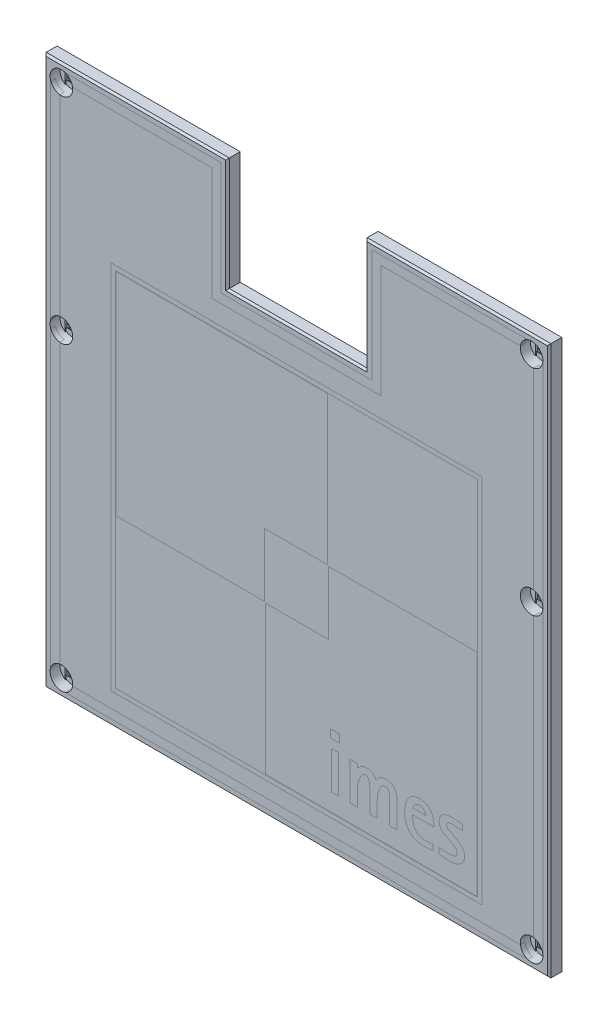
from build123d import *
from build123d.topology import SkipClean

# Parameters (mm, degrees)
SKETCH1_R                 = 1.35
BOSS_EXTRUDE1_DEPTH       = 2.8
SKETCH3_R                 = 2.5
CUT_EXTRUDE1_DEPTH        = 2.2
SKETCH4_W                 = 91.5
SKETCH4_H                 = 85.5
CUT_EXTRUDE2_DEPTH        = 1.5
CUT_EXTRUDE3_DEPTH        = 0.2
SKETCH6_W                 = 2.7
SKETCH6_H                 = 2.7
CUT_EXTRUDE4_DEPTH        = 0.2
CHAMFER1_SIZE             = 0.4
CUT_EXTRUDE5_DEPTH        = 1
BOSS_EXTRUDE2_DEPTH       = 1
BOSS_EXTRUDE2_2_DEPTH     = 1
SKETCH10_W                = 82
SKETCH10_H                = 82
SKETCH10_W_2              = 80
SKETCH10_H_2              = 80
CUT_EXTRUDE6_DEPTH        = 1
SKETCH10_2_W              = 82
SKETCH10_2_H              = 82
SKETCH10_2_W_2            = 80
SKETCH10_2_H_2            = 80
BOSS_EXTRUDE3_DEPTH       = 1
CUT_EXTRUDE7_START        = -1
CUT_EXTRUDE7_OUTLINE_W    = 1.635
CUT_EXTRUDE7_OUTLINE_H    = 8.32
CUT_EXTRUDE7_OUTLINE_W_2  = 1.94
CUT_EXTRUDE7_OUTLINE_H_2  = 1.76
CUT_EXTRUDE7_DEPTH        = 1
BOSS_EXTRUDE4_START       = -1
BOSS_EXTRUDE4_OUTLINE_W   = 1.635
BOSS_EXTRUDE4_OUTLINE_H   = 8.32
BOSS_EXTRUDE4_OUTLINE_W_2 = 1.94
BOSS_EXTRUDE4_OUTLINE_H_2 = 1.76
BOSS_EXTRUDE4_DEPTH       = 1
CUT_EXTRUDE8_DEPTH        = 1
BOSS_EXTRUDE5_DEPTH       = 1
BOSS_EXTRUDE5_2_DEPTH     = 1
BOSS_EXTRUDE5_3_DEPTH     = 1
BOSS_EXTRUDE5_4_DEPTH     = 1
BOSS_EXTRUDE5_5_DEPTH     = 1
BOSS_EXTRUDE5_6_DEPTH     = 1


# Read off the part's stored shape, not the designer's step: Cut-Extrude7, Boss-Extrude4
with BuildPart() as part:
    # Sketch1 → Boss-Extrude1 (new body)
    with BuildSketch(Plane.XY):
        Polygon((-15.25, 53.75), (-15.25, 28.75), (15.25, 28.75), (15.25, 53.75), (55.875, 53.75), (55.875, -67.75), (-55.75, -67.75), (-55.75, 53.75), align=None)
        with Locations((-52, 50)):
            Circle(SKETCH1_R, mode=Mode.SUBTRACT)
        with Locations((-52, 2.6)):
            Circle(SKETCH1_R, mode=Mode.SUBTRACT)
        with Locations((-52, -64)):
            Circle(SKETCH1_R, mode=Mode.SUBTRACT)
        with Locations((52, 50)):
            Circle(SKETCH1_R, mode=Mode.SUBTRACT)
        with Locations((52, 2.6)):
            Circle(SKETCH1_R, mode=Mode.SUBTRACT)
        with Locations((52, -64)):
            Circle(SKETCH1_R, mode=Mode.SUBTRACT)
    extrude(amount=BOSS_EXTRUDE1_DEPTH)

    # Sketch3 → Cut-Extrude1 (cut)
    with BuildSketch(Plane.XY.offset(2.8)):
        with Locations((-52, 50)):
            Circle(SKETCH3_R)
        with Locations((-52, 2.6)):
            Circle(SKETCH3_R)
        with Locations((-52, -64)):
            Circle(SKETCH3_R)
        with Locations((52, -64)):
            Circle(SKETCH3_R)
        with Locations((52, 2.6)):
            Circle(SKETCH3_R)
        with Locations((52, 50)):
            Circle(SKETCH3_R)
    extrude(amount=-CUT_EXTRUDE1_DEPTH, mode=Mode.SUBTRACT)

    # Sketch4 → Cut-Extrude2 (cut)
    with BuildSketch(Plane(origin=(0, 0, 0), x_dir=(-1, 0, 0), z_dir=(0, 0, -1))):
        with Locations((0, -15)):
            Rectangle(SKETCH4_W, SKETCH4_H)
    extrude(amount=-CUT_EXTRUDE2_DEPTH, mode=Mode.SUBTRACT)

    # Sketch5 → Cut-Extrude3 (cut)
    with SkipClean():  # the faces are left unmerged after this step: merging them gives an invalid solid
        with BuildSketch(Plane.XY.offset(0.6)):
            with BuildLine():
                Line((-53.35, 47.895837459), (-53.35, 52.104162541))
                ThreePointArc((-53.35, 52.104162541), (-52, 52.5), (-50.65, 52.104162541))
                Line((-50.65, 52.104162541), (-50.65, 47.895837459))
                ThreePointArc((-50.65, 47.895837459), (-52, 47.5), (-53.35, 47.895837459))
            make_face()
            with BuildLine():
                Line((-53.35, 0.495837459), (-53.35, 4.704162541))
                ThreePointArc((-53.35, 4.704162541), (-52, 5.1), (-50.65, 4.704162541))
                Line((-50.65, 4.704162541), (-50.65, 0.495837459))
                ThreePointArc((-50.65, 0.495837459), (-52, 0.1), (-53.35, 0.495837459))
            make_face()
            with BuildLine():
                Line((-53.35, -66.104162541), (-53.35, -61.895837459))
                ThreePointArc((-53.35, -61.895837459), (-52, -61.5), (-50.65, -61.895837459))
                Line((-50.65, -61.895837459), (-50.65, -66.104162541))
                ThreePointArc((-50.65, -66.104162541), (-52, -66.5), (-53.35, -66.104162541))
            make_face()
        cut_extrude3 = extrude(amount=-CUT_EXTRUDE3_DEPTH, mode=Mode.SUBTRACT)

    # Sketch6 → Cut-Extrude4 (cut)
    with SkipClean():  # the faces are left unmerged after this step: merging them gives an invalid solid
        with BuildSketch(Plane.XY.offset(0.4)):
            with Locations((-52, -64)):
                Rectangle(SKETCH6_W, SKETCH6_H)
            with Locations((-52, 2.6)):
                Rectangle(SKETCH6_W, SKETCH6_H)
            with Locations((-52, 50)):
                Rectangle(SKETCH6_W, SKETCH6_H)
        cut_extrude4 = extrude(amount=-CUT_EXTRUDE4_DEPTH, mode=Mode.SUBTRACT)

    # Mirror1: Cut-Extrude3, Cut-Extrude4 across plane
    with SkipClean():  # the faces are left unmerged after this step: merging them gives an invalid solid
        add(cut_extrude3.mirror(Plane(origin=(0, 0, 0), x_dir=(0, 0, 1), z_dir=(1, 0, 0))), mode=Mode.SUBTRACT)
        add(cut_extrude4.mirror(Plane(origin=(0, 0, 0), x_dir=(0, 0, 1), z_dir=(1, 0, 0))), mode=Mode.SUBTRACT)

    # Chamfer1
    chamfer1_edges = [part.edges().sort_by_distance(p)[0] for p in [
        (55.875, -7, 2.8),
        (35.5625, 53.75, 2.8),
        (15.25, 41.25, 2.8),
        (0, 28.75, 2.8),
        (-15.25, 41.25, 2.8),
        (-35.5, 53.75, 2.8),
        (-55.75, -7, 2.8),
        (0.0625, -67.75, 2.8),
    ]]
    chamfer(chamfer1_edges, length=CHAMFER1_SIZE)

    # Sketch8 → Cut-Extrude5 (cut)
    with SkipClean():  # the faces are left unmerged after this step: merging them gives an invalid solid
        with BuildSketch(Plane.XY.offset(2.8)):
            Polygon((6.9, -12.9), (6.9, 19.9), (-39.9, 19.9), (-39.9, -26.9), (-7.1, -26.9), (-7.1, -12.9), align=None)
            Polygon((7.1, -13.1), (39.9, -13.1), (39.9, -59.9), (-6.9, -59.9), (-6.9, -27.1), (7.1, -27.1), align=None)
        extrude(amount=-CUT_EXTRUDE5_DEPTH, mode=Mode.SUBTRACT)

    # Sketch10 → Cut-Extrude6 (cut)
    with SkipClean():  # the faces are left unmerged after this step: merging them gives an invalid solid
        with BuildSketch(Plane.XY.offset(2.8)):
            with Locations((0, -20)):
                Rectangle(SKETCH10_W, SKETCH10_H)
            with Locations((0, -20)):
                Rectangle(SKETCH10_W_2, SKETCH10_H_2, mode=Mode.SUBTRACT)
        extrude(amount=-CUT_EXTRUDE6_DEPTH, mode=Mode.SUBTRACT)

    # Sketch12 → Cut-Extrude8 (cut)
    with SkipClean():  # the faces are left unmerged after this step: merging them gives an invalid solid
        with BuildSketch(Plane.XY.offset(2.8)):
            with BuildLine():
                Line((51.147063895, 52.35), (16.65, 52.35))
                Line((16.65, 52.35), (16.65, 27.35))
                Line((16.65, 27.35), (-16.65, 27.35))
                Line((-16.65, 27.35), (-16.65, 52.35))
                Line((-16.65, 52.35), (-51.147063895, 52.35))
                ThreePointArc((-51.147063895, 52.35), (-50.05850059, 51.574985727), (-49.524621241, 50.35))
                Line((-49.524621241, 50.35), (-18.65, 50.35))
                Line((-18.65, 50.35), (-18.65, 25.35))
                Line((-18.65, 25.35), (18.65, 25.35))
                Line((18.65, 25.35), (18.65, 50.35))
                Line((18.65, 50.35), (49.524621241, 50.35))
                ThreePointArc((49.524621241, 50.35), (50.05850059, 51.574985727), (51.147063895, 52.35))
            make_face()
            with BuildLine():
                Line((52.475, 5.054460226), (52.475, 47.545539774))
                ThreePointArc((52.475, 47.545539774), (53.811079021, 48.276633301), (54.475, 49.647331601))
                Line((54.475, 49.647331601), (54.475, 2.952668399))
                ThreePointArc((54.475, 2.952668399), (53.811079021, 4.323366699), (52.475, 5.054460226))
            make_face()
            with BuildLine():
                Line((-52.35, 0.124621241), (-52.35, -61.524621241))
                ThreePointArc((-52.35, -61.524621241), (-53.574985727, -62.05850059), (-54.35, -63.147063895))
                Line((-54.35, -63.147063895), (-54.35, 1.747063895))
                ThreePointArc((-54.35, 1.747063895), (-53.574985727, 0.65850059), (-52.35, 0.124621241))
            make_face()
            with BuildLine():
                Line((-54.35, 49.147063895), (-54.35, 3.452936105))
                ThreePointArc((-54.35, 3.452936105), (-53.574985727, 4.54149941), (-52.35, 5.075378759))
                Line((-52.35, 5.075378759), (-52.35, 47.524621241))
                ThreePointArc((-52.35, 47.524621241), (-53.574985727, 48.05850059), (-54.35, 49.147063895))
            make_face()
            with BuildLine():
                Line((-51.147063895, -66.35), (51.147063895, -66.35))
                ThreePointArc((51.147063895, -66.35), (50.05850059, -65.574985727), (49.524621241, -64.35))
                Line((49.524621241, -64.35), (-49.524621241, -64.35))
                ThreePointArc((-49.524621241, -64.35), (-50.05850059, -65.574985727), (-51.147063895, -66.35))
            make_face()
            with BuildLine():
                Line((54.475, -63.647331601), (54.475, 2.247331601))
                ThreePointArc((54.475, 2.247331601), (53.811079021, 0.876633301), (52.475, 0.145539774))
                Line((52.475, 0.145539774), (52.475, -61.545539774))
                ThreePointArc((52.475, -61.545539774), (53.811079021, -62.276633301), (54.475, -63.647331601))
            make_face()
        extrude(amount=-CUT_EXTRUDE8_DEPTH, mode=Mode.SUBTRACT)


with BuildPart() as body_2:
    # Sketch9 → Boss-Extrude2 (new body)
    with BuildSketch(Plane.XY.offset(1.8)):
        Polygon((39.9, -59.9), (39.9, -13.1), (7.1, -13.1), (7.1, -27.1), (-6.9, -27.1), (-6.9, -59.9), align=None)
    extrude(amount=BOSS_EXTRUDE2_DEPTH)

    # Cut-Extrude7 outline → Cut-Extrude7 (cut)
    # profile 1 of 5: a face of its own
    with BuildSketch(Plane.XY.offset(2.8).offset(CUT_EXTRUDE7_START)):
        with BuildLine():
            add(Edge.make_bspline(
                [(31.520459916, -54.72), (31.630427377, -54.731182686), (31.843603955, -54.752860796), (32.153091085, -54.778570637), (32.440447598, -54.806827377), (32.796651345, -54.841381981), (33.235755714, -54.87281791), (33.58706238, -54.877581165), (33.765459916, -54.88)],
                knots=[0, 0, 0, 0, 0.147269477, 0.285488116, 0.413756125, 0.53197116, 0.762329612, 1, 1, 1, 1], degree=3))
            Line((31.520459916, -54.72), (31.520459916, -55.98))
            add(Edge.make_bspline(
                [(33.885459916, -56.16), (33.697090473, -56.157077545), (33.314262679, -56.151138167), (32.731211473, -56.118574014), (32.13106025, -56.060153814), (31.726152205, -56.007001331), (31.520459916, -55.98)],
                knots=[0, 0, 0, 0, 0.238089541, 0.483875157, 0.737809853, 1, 1, 1, 1], degree=3))
            add(Edge.make_bspline(
                [(37.205459916, -53.5975), (37.20333471, -53.706084515), (37.19922283, -53.916175408), (37.146126775, -54.218538928), (37.069130031, -54.499058325), (36.951548025, -54.753332217), (36.807309638, -54.984027916), (36.64180186, -55.19827446), (36.444943527, -55.386837877), (36.226400229, -55.557812543), (35.987633381, -55.707200868), (35.727782533, -55.832687111), (35.45263921, -55.940692208), (35.158816143, -56.021519062), (34.853720028, -56.083268359), (34.53912287, -56.128890852), (34.215005089, -56.153066547), (33.996328482, -56.157667385), (33.885459916, -56.16)],
                knots=[0, 0, 0, 0, 0.06869843, 0.132918718, 0.19390058, 0.252486582, 0.30961806, 0.36601068, 0.423499545, 0.481789897, 0.541550867, 0.601516658, 0.664355231, 0.72852777, 0.794268313, 0.861457425, 0.929759215, 1, 1, 1, 1], degree=3))
            add(Edge.make_bspline(
                [(35.152959916, -51.055), (35.300724295, -51.137308537), (35.58723823, -51.296904125), (35.984011337, -51.558232959), (36.335547149, -51.830223752), (36.595028748, -52.067832941), (36.77775913, -52.266076561), (36.891035125, -52.426568886), (36.987777008, -52.595758794), (37.070286267, -52.774822655), (37.127979946, -52.96633288), (37.175153709, -53.167190701), (37.198377128, -53.379466615), (37.203076397, -53.524126809), (37.205459916, -53.5975)],
                knots=[0, 0, 0, 0, 0.146602911, 0.284261859, 0.41143371, 0.531573362, 0.588871508, 0.644805216, 0.701439079, 0.757703084, 0.815282929, 0.874524845, 0.936357665, 1, 1, 1, 1], degree=3))
            Line((35.152959916, -51.055), (34.522959916, -50.7125))
            add(Edge.make_bspline(
                [(33.220459916, -49.565), (33.224980368, -49.635951871), (33.233440024, -49.768732516), (33.317837187, -49.949651491), (33.453273196, -50.090586993), (33.615120664, -50.222599766), (33.810003776, -50.341789008), (34.025645806, -50.463454985), (34.269213861, -50.580059476), (34.43573295, -50.666972651), (34.522959916, -50.7125)],
                knots=[0, 0, 0, 0, 0.115632082, 0.216396018, 0.318864986, 0.433339301, 0.557913864, 0.692342793, 0.83884127, 1, 1, 1, 1], degree=3))
            add(Edge.make_bspline(
                [(34.495459916, -48.8), (34.403749255, -48.802055302), (34.229873945, -48.805951972), (33.9822984, -48.831192341), (33.763978534, -48.882557761), (33.572487051, -48.945791152), (33.409652716, -49.039632652), (33.298606506, -49.183574693), (33.230808175, -49.362728766), (33.224075979, -49.494318982), (33.220459916, -49.565)],
                knots=[0, 0, 0, 0, 0.16263944, 0.308350005, 0.440251024, 0.559421834, 0.665611291, 0.767606011, 0.875174278, 1, 1, 1, 1], degree=3))
            add(Edge.make_bspline(
                [(36.697959916, -48.96), (36.569611721, -48.948490665), (36.327041759, -48.92673875), (35.985504249, -48.893716725), (35.686351294, -48.865956959), (35.346548842, -48.836250343), (34.954352462, -48.804845049), (34.647198867, -48.80160208), (34.495459916, -48.8)],
                knots=[0, 0, 0, 0, 0.174996226, 0.330731786, 0.465974926, 0.582981318, 0.793985882, 1, 1, 1, 1], degree=3))
            Line((36.697959916, -48.96), (36.697959916, -47.7225))
            add(Edge.make_bspline(
                [(34.477959916, -47.52), (34.643013917, -47.522586355), (34.970156375, -47.527712597), (35.382816642, -47.557730433), (35.727918649, -47.596967108), (36.02113047, -47.626271206), (36.347847729, -47.675057686), (36.577090543, -47.70612147), (36.697959916, -47.7225)],
                knots=[0, 0, 0, 0, 0.221924356, 0.439861372, 0.555926354, 0.688942107, 0.835993234, 1, 1, 1, 1], degree=3))
            add(Edge.make_bspline(
                [(31.552959916, -49.725), (31.555967634, -49.627370608), (31.561807565, -49.437808584), (31.602927792, -49.165199054), (31.677128084, -48.916240618), (31.776014452, -48.688826998), (31.906562478, -48.487273649), (32.050549818, -48.301233263), (32.2205372, -48.141855775), (32.407736102, -47.999314262), (32.614906768, -47.878509362), (32.839672588, -47.774232138), (33.082598695, -47.693369691), (33.432313265, -47.606336703), (33.899301987, -47.534409076), (34.281834542, -47.524883689), (34.477959916, -47.52)],
                knots=[0, 0, 0, 0, 0.070383998, 0.13666103, 0.19806154, 0.25723182, 0.314737786, 0.370752562, 0.426418292, 0.482171488, 0.540077761, 0.598948381, 0.660504474, 0.724326199, 0.85866137, 1, 1, 1, 1], degree=3))
            add(Edge.make_bspline(
                [(33.470459916, -51.965), (33.353005623, -51.904920089), (33.119073438, -51.785259714), (32.77030412, -51.608686519), (32.443024903, -51.406625574), (32.151807968, -51.165062825), (31.903342509, -50.88330897), (31.739372623, -50.612147974), (31.642679575, -50.370555604), (31.591500783, -50.169701361), (31.557396866, -49.952824875), (31.554471977, -49.802640059), (31.552959916, -49.725)],
                knots=[0, 0, 0, 0, 0.125729609, 0.250414024, 0.372476009, 0.491442544, 0.609629887, 0.728937866, 0.791317999, 0.857002591, 0.926075568, 1, 1, 1, 1], degree=3))
            Line((33.470459916, -51.965), (34.195459916, -52.355))
            add(Edge.make_bspline(
                [(35.522959916, -53.705), (35.517873196, -53.62149059), (35.508097652, -53.461004111), (35.412722454, -53.239246327), (35.270902047, -53.049495634), (35.089984217, -52.884491582), (34.885495342, -52.730602011), (34.656687279, -52.601957673), (34.424476234, -52.478655298), (34.271252343, -52.395923438), (34.195459916, -52.355)],
                knots=[0, 0, 0, 0, 0.124640811, 0.239531869, 0.355774633, 0.477787133, 0.605522775, 0.738853121, 0.870823307, 1, 1, 1, 1], degree=3))
            add(Edge.make_bspline(
                [(33.765459916, -54.88), (33.870553891, -54.877433685), (34.082228327, -54.872264756), (34.395708805, -54.835567223), (34.695252935, -54.770510806), (34.966172952, -54.661064216), (35.195663118, -54.504433111), (35.350782625, -54.334570933), (35.439465069, -54.172000518), (35.491522594, -54.031919826), (35.516739026, -53.873397197), (35.520833337, -53.762565725), (35.522959916, -53.705)],
                knots=[0, 0, 0, 0, 0.131801044, 0.265466329, 0.395279638, 0.515238543, 0.629468899, 0.741268081, 0.799744235, 0.860914015, 0.927758916, 1, 1, 1, 1], degree=3))
        make_face()
    # profile 2 of 5: a face of its own
    with BuildSketch(Plane.XY.offset(2.8).offset(CUT_EXTRUDE7_START)):
        with BuildLine():
            add(Edge.make_bspline(
                [(30.195459916, -55.945), (30.084786077, -55.967555736), (29.872341891, -56.010852644), (29.563340944, -56.059132915), (29.278759782, -56.101656264), (28.931026504, -56.133421684), (28.515684843, -56.152383403), (28.187976283, -56.157474992), (28.025459916, -56.16)],
                knots=[0, 0, 0, 0, 0.155051049, 0.297628546, 0.429338912, 0.55001723, 0.776845729, 1, 1, 1, 1], degree=3))
            Line((30.195459916, -55.945), (30.195459916, -54.72))
            add(Edge.make_bspline(
                [(28.280459916, -54.88), (28.418030402, -54.878365777), (28.68352042, -54.875211978), (29.017603813, -54.847271602), (29.299570658, -54.815354574), (29.555488329, -54.788583817), (29.859597955, -54.755570384), (30.077953835, -54.732444804), (30.195459916, -54.72)],
                knots=[0, 0, 0, 0, 0.214604371, 0.414153647, 0.522707046, 0.657394425, 0.81563016, 1, 1, 1, 1], degree=3))
            add(Edge.make_bspline(
                [(25.682959916, -51.4475), (25.685037079, -51.575043621), (25.689101309, -51.824598792), (25.716316882, -52.191152831), (25.764181961, -52.540740789), (25.827601332, -52.87276408), (25.911895985, -53.184350435), (26.018698505, -53.471583567), (26.146621216, -53.733897549), (26.294724845, -53.9703764), (26.462138442, -54.182941215), (26.653458647, -54.365586917), (26.863408543, -54.522413928), (27.093413248, -54.654490315), (27.349521022, -54.758265662), (27.634683084, -54.829579599), (27.948376805, -54.871533021), (28.166992296, -54.877106965), (28.280459916, -54.88)],
                knots=[0, 0, 0, 0, 0.077943909, 0.152507084, 0.224457537, 0.293471641, 0.3589511, 0.421476523, 0.480465396, 0.536984446, 0.591703597, 0.645369899, 0.698129676, 0.751505232, 0.807017269, 0.866428896, 0.930672821, 1, 1, 1, 1], degree=3))
            Line((25.682959916, -51.4475), (25.682959916, -51.36))
            Line((25.682959916, -51.36), (30.380459916, -51.36))
            Line((30.380459916, -51.36), (30.380459916, -50.8275))
            add(Edge.make_bspline(
                [(27.245459916, -47.52), (27.373964026, -47.523357736), (27.623656106, -47.529882042), (27.986562496, -47.580510433), (28.325931839, -47.664178178), (28.639274799, -47.785779955), (28.92815719, -47.933612321), (29.191208158, -48.105477269), (29.426998273, -48.302785677), (29.633417917, -48.523731925), (29.816811263, -48.76102524), (29.972803249, -49.016137035), (30.103083889, -49.285702322), (30.204456455, -49.570525142), (30.286373448, -49.866853473), (30.338293148, -50.176961352), (30.376481697, -50.498220007), (30.379119414, -50.716545687), (30.380459916, -50.8275)],
                knots=[0, 0, 0, 0, 0.074895797, 0.145527543, 0.213163343, 0.278216229, 0.341011188, 0.402052602, 0.46102301, 0.519792947, 0.57799992, 0.63557697, 0.693812321, 0.752213614, 0.811612744, 0.872797063, 0.935354767, 1, 1, 1, 1], degree=3))
            add(Edge.make_bspline(
                [(23.930459916, -51.5725), (23.932204321, -51.441605183), (23.935665326, -51.18190187), (23.968704318, -50.796922256), (24.024898622, -50.42084027), (24.097173884, -50.05302198), (24.199593917, -49.700290085), (24.326082447, -49.36419792), (24.485660339, -49.051791982), (24.666630329, -48.756909183), (24.880384022, -48.488149389), (25.124749224, -48.245597209), (25.400961038, -48.033638033), (25.705572866, -47.848763576), (26.043206058, -47.698994716), (26.415738714, -47.597126592), (26.819624202, -47.528754071), (27.100154185, -47.522987107), (27.245459916, -47.52)],
                knots=[0, 0, 0, 0, 0.066228285, 0.131400963, 0.19533259, 0.258600144, 0.320927539, 0.380995649, 0.440024523, 0.498179297, 0.555805715, 0.613356478, 0.671978757, 0.731571309, 0.793313914, 0.858189864, 0.926546797, 1, 1, 1, 1], degree=3))
            add(Edge.make_bspline(
                [(28.025459916, -56.16), (27.850236945, -56.155846343), (27.511843835, -56.147824741), (27.023612012, -56.081743709), (26.573714195, -55.976180043), (26.162615915, -55.825325196), (25.789146269, -55.634324848), (25.452719374, -55.404411033), (25.147181912, -55.143848821), (24.878190978, -54.846733038), (24.647706401, -54.517748681), (24.444757835, -54.165866748), (24.279997015, -53.786498499), (24.151441182, -53.382069917), (24.051349676, -52.956550269), (23.983000703, -52.510929782), (23.939194142, -52.04753958), (23.933403578, -51.732600744), (23.930459916, -51.5725)],
                knots=[0, 0, 0, 0, 0.075082455, 0.145000312, 0.210759505, 0.2728037, 0.332233427, 0.39009334, 0.447086706, 0.503985964, 0.561373119, 0.618971115, 0.677836717, 0.738272401, 0.800656026, 0.865020832, 0.93138266, 1, 1, 1, 1], degree=3))
        make_face()
        with BuildLine():
            add(Edge.make_bspline(
                [(28.612959916, -50.08), (28.608757096, -50.004461105), (28.600263249, -49.851797947), (28.525153845, -49.627428699), (28.405058638, -49.411233486), (28.244320889, -49.204914782), (28.041264049, -49.022861851), (27.792015779, -48.891020192), (27.505224709, -48.811860981), (27.301827013, -48.804072826), (27.195459916, -48.8)],
                knots=[0, 0, 0, 0, 0.106534394, 0.215304672, 0.330739093, 0.454910568, 0.583441027, 0.71307311, 0.849951201, 1, 1, 1, 1], degree=3))
            Line((28.612959916, -50.08), (25.767959916, -50.08))
            add(Edge.make_bspline(
                [(27.195459916, -48.8), (27.101602211, -48.804506269), (26.918999532, -48.813273335), (26.659216392, -48.890075524), (26.427529704, -49.018702465), (26.23021602, -49.194817142), (26.066190662, -49.39932961), (25.929115007, -49.614817613), (25.825892934, -49.841890727), (25.787207828, -50.000889564), (25.767959916, -50.08)],
                knots=[0, 0, 0, 0, 0.135235235, 0.26310377, 0.386926549, 0.514772458, 0.642125267, 0.764254342, 0.88270391, 1, 1, 1, 1], degree=3))
        make_face(mode=Mode.SUBTRACT)
    # profile 3 of 5: a face of its own
    with BuildSketch(Plane.XY.offset(2.8).offset(CUT_EXTRUDE7_START)):
        with BuildLine():
            add(Edge.make_bspline(
                [(16.227959916, -51.365), (16.227206269, -51.200767839), (16.225739896, -50.88122092), (16.199585289, -50.489760891), (16.176659422, -50.194025972), (16.142606126, -49.992456772), (16.104213934, -49.806546289), (16.053697073, -49.637748979), (15.995083569, -49.485583023), (15.924820579, -49.35061592), (15.841775335, -49.234145041), (15.746369663, -49.135624833), (15.636397011, -49.053941901), (15.505710433, -49.000764436), (15.35919107, -48.963504342), (15.254890713, -48.96120168), (15.200459916, -48.96)],
                knots=[0, 0, 0, 0, 0.168643311, 0.328129705, 0.402912238, 0.473132117, 0.537936687, 0.597786467, 0.653895815, 0.70520335, 0.75366147, 0.800269945, 0.845643802, 0.893186096, 0.94425747, 1, 1, 1, 1], degree=3))
            Line((16.227959916, -51.365), (16.227959916, -56))
            Line((16.227959916, -56), (17.860459916, -56))
            Line((17.860459916, -56), (17.860459916, -52.555))
            add(Edge.make_bspline(
                [(18.082959916, -50.8225), (18.048587743, -50.962933733), (17.979875977, -51.243668088), (17.910159189, -51.673907707), (17.870293109, -52.111734677), (17.863752258, -52.406586246), (17.860459916, -52.555)],
                knots=[0, 0, 0, 0, 0.247579281, 0.494923892, 0.745769569, 1, 1, 1, 1], degree=3))
            add(Edge.make_bspline(
                [(19.557959916, -48.96), (19.484392959, -48.965608979), (19.332833, -48.977164392), (19.115854929, -49.083260267), (18.904546031, -49.241436401), (18.7085735, -49.465203598), (18.522046458, -49.736877662), (18.355310274, -50.058461214), (18.205821588, -50.423612628), (18.125022391, -50.685938371), (18.082959916, -50.8225)],
                knots=[0, 0, 0, 0, 0.087074155, 0.179386993, 0.282103009, 0.400016563, 0.531197601, 0.673561827, 0.830062699, 1, 1, 1, 1], degree=3))
            add(Edge.make_bspline(
                [(20.585459916, -51.1475), (20.584507391, -50.999941542), (20.582648968, -50.712047858), (20.554449635, -50.297327339), (20.512370276, -49.918619402), (20.436471535, -49.63612108), (20.354671374, -49.442131697), (20.284090878, -49.317362469), (20.202397896, -49.209746097), (20.107711569, -49.119164334), (19.997048283, -49.047356118), (19.867803715, -48.994171687), (19.718387023, -48.9652766), (19.613078686, -48.961812909), (19.557959916, -48.96)],
                knots=[0, 0, 0, 0, 0.162575596, 0.317192848, 0.457988942, 0.581870792, 0.637823834, 0.689653026, 0.739431962, 0.786205983, 0.833330308, 0.883982626, 0.939276081, 1, 1, 1, 1], degree=3))
            Line((20.585459916, -51.1475), (20.585459916, -56))
            Line((20.585459916, -56), (22.217959916, -56))
            Line((22.217959916, -56), (22.217959916, -50.31))
            add(Edge.make_bspline(
                [(19.795459916, -47.52), (19.897221296, -47.522474774), (20.093878037, -47.527257344), (20.377946247, -47.56173339), (20.641067343, -47.622048804), (20.883067847, -47.705812123), (21.104600022, -47.81527616), (21.305778374, -47.947339312), (21.484518663, -48.106220477), (21.639759275, -48.288910312), (21.777028707, -48.488409629), (21.894598151, -48.705160441), (21.994641443, -48.936131974), (22.077794149, -49.181705305), (22.139346232, -49.443083886), (22.184058817, -49.718764817), (22.212006675, -50.009431137), (22.215944991, -50.208269921), (22.217959916, -50.31)],
                knots=[0, 0, 0, 0, 0.07249626, 0.140101072, 0.203472185, 0.264499758, 0.322119417, 0.379096155, 0.435453918, 0.491867947, 0.549509016, 0.607697901, 0.667260914, 0.728657063, 0.792164317, 0.858343602, 0.927525625, 1, 1, 1, 1], degree=3))
            add(Edge.make_bspline(
                [(17.561068707, -48.841563985), (17.616355031, -48.739461957), (17.750988107, -48.528606713), (18.000214042, -48.238051636), (18.303653552, -47.979520132), (18.641085204, -47.773656342), (19.00626179, -47.627814104), (19.393536619, -47.536870053), (19.659958554, -47.525687441), (19.795459916, -47.52)],
                knots=[0.155412542, 0.155412542, 0.155412542, 0.155412542, 0.263309408, 0.386900601, 0.509988286, 0.632340121, 0.752592156, 0.874169144, 1, 1, 1, 1], degree=3))
            add(Edge.make_bspline(
                [(15.537959916, -47.52), (15.626379489, -47.520884776), (15.797854542, -47.522600651), (16.04510819, -47.551517422), (16.274049379, -47.593745484), (16.486165172, -47.649573462), (16.678367603, -47.727756719), (16.853376159, -47.820570891), (17.009927227, -47.930355566), (17.144076699, -48.059308459), (17.262471704, -48.197880892), (17.364771625, -48.343934801), (17.448216461, -48.498454401), (17.513626343, -48.659401522), (17.546488111, -48.775498465), (17.560053205, -48.836871533), (17.561068707, -48.841563985)],
                knots=[0, 0, 0, 0, 0.083602583, 0.162133303, 0.235117759, 0.303779966, 0.369220914, 0.430947208, 0.490885434, 0.549444138, 0.606481158, 0.663124513, 0.717802499, 0.772264072, 0.827168938, 0.831709769, 0.831709769, 0.831709769, 0.831709769], degree=3))
            add(Edge.make_bspline(
                [(13.500459915, -48.570436948), (13.549055993, -48.501236586), (13.682151931, -48.327238444), (13.937094232, -48.0793384), (14.269199137, -47.840687086), (14.581156984, -47.691270385), (14.849750978, -47.600078374), (15.067879106, -47.553587055), (15.29891553, -47.526046863), (15.457048544, -47.522046733), (15.537959916, -47.52)],
                knots=[0.262208278, 0.262208278, 0.262208278, 0.262208278, 0.340566475, 0.465217049, 0.590503782, 0.718446065, 0.784457851, 0.853306325, 0.924941755, 1, 1, 1, 1], degree=3))
            Line((13.500459915, -48.570436948), (13.500459916, -47.68))
            Line((13.500459916, -47.68), (11.867959916, -47.68))
            Line((11.867959916, -47.68), (11.867959916, -56))
            Line((11.867959916, -56), (13.500459916, -56))
            Line((13.500459916, -56), (13.500459916, -52.555))
            add(Edge.make_bspline(
                [(13.660459916, -51.1675), (13.635951324, -51.284783875), (13.586969746, -51.519181236), (13.535123219, -51.871253618), (13.503590142, -52.216908789), (13.501486646, -52.444104371), (13.500459916, -52.555)],
                knots=[0, 0, 0, 0, 0.256771702, 0.51317037, 0.762375317, 1, 1, 1, 1], degree=3))
            add(Edge.make_bspline(
                [(15.200459916, -48.96), (15.124158898, -48.966849618), (14.964687565, -48.981165517), (14.736723955, -49.105120371), (14.513009412, -49.292691765), (14.302414418, -49.558497709), (14.10440844, -49.889317533), (13.928261754, -50.276571989), (13.776339838, -50.707811514), (13.699709034, -51.011801177), (13.660459916, -51.1675)],
                knots=[0, 0, 0, 0, 0.079712738, 0.166601924, 0.266666644, 0.385448458, 0.520531456, 0.670898108, 0.83143908, 1, 1, 1, 1], degree=3))
        make_face()
    # profile 4 of 5: a face of its own
    with BuildSketch(Plane.XY.offset(2.8).offset(CUT_EXTRUDE7_START)):
        with Locations((8.517959916, -51.84)):
            Rectangle(CUT_EXTRUDE7_OUTLINE_W, CUT_EXTRUDE7_OUTLINE_H)
    # profile 5 of 5: a face of its own
    with BuildSketch(Plane.XY.offset(2.8).offset(CUT_EXTRUDE7_START)):
        with Locations((8.517959916, -44.88)):
            Rectangle(CUT_EXTRUDE7_OUTLINE_W_2, CUT_EXTRUDE7_OUTLINE_H_2)
    extrude(amount=CUT_EXTRUDE7_DEPTH, mode=Mode.SUBTRACT)


with BuildPart() as body_3:
    # Sketch9 → Boss-Extrude2 2 (new body)
    with BuildSketch(Plane.XY.offset(1.8)):
        Polygon((-7.1, -12.9), (6.9, -12.9), (6.9, 19.9), (-39.9, 19.9), (-39.9, -26.9), (-7.1, -26.9), align=None)
    extrude(amount=BOSS_EXTRUDE2_2_DEPTH)


with BuildPart() as body_4:
    # Sketch10<2> → Boss-Extrude3 (new body)
    with BuildSketch(Plane.XY.offset(2.8)):
        with Locations((0, -20)):
            Rectangle(SKETCH10_2_W, SKETCH10_2_H)
        with Locations((0, -20)):
            Rectangle(SKETCH10_2_W_2, SKETCH10_2_H_2, mode=Mode.SUBTRACT)
    extrude(amount=-BOSS_EXTRUDE3_DEPTH)


with BuildPart() as body_5:
    # Boss-Extrude4 outline → Boss-Extrude4 (new body)
    # profile 1 of 5: a face of its own
    with BuildSketch(Plane.XY.offset(2.8).offset(BOSS_EXTRUDE4_START)):
        with BuildLine():
            Line((31.520459916, -54.72), (31.520459916, -55.98))
            add(Edge.make_bspline(
                [(33.885459916, -56.16), (33.697090473, -56.157077545), (33.314262679, -56.151138167), (32.731211473, -56.118574014), (32.13106025, -56.060153814), (31.726152205, -56.007001331), (31.520459916, -55.98)],
                knots=[0, 0, 0, 0, 0.238089541, 0.483875157, 0.737809853, 1, 1, 1, 1], degree=3))
            add(Edge.make_bspline(
                [(37.205459916, -53.5975), (37.20333471, -53.706084515), (37.19922283, -53.916175408), (37.146126775, -54.218538928), (37.069130031, -54.499058325), (36.951548025, -54.753332217), (36.807309638, -54.984027916), (36.64180186, -55.19827446), (36.444943527, -55.386837877), (36.226400229, -55.557812543), (35.987633381, -55.707200868), (35.727782533, -55.832687111), (35.45263921, -55.940692208), (35.158816143, -56.021519062), (34.853720028, -56.083268359), (34.53912287, -56.128890852), (34.215005089, -56.153066547), (33.996328482, -56.157667385), (33.885459916, -56.16)],
                knots=[0, 0, 0, 0, 0.06869843, 0.132918718, 0.19390058, 0.252486582, 0.30961806, 0.36601068, 0.423499545, 0.481789897, 0.541550867, 0.601516658, 0.664355231, 0.72852777, 0.794268313, 0.861457425, 0.929759215, 1, 1, 1, 1], degree=3))
            add(Edge.make_bspline(
                [(35.152959916, -51.055), (35.300724295, -51.137308537), (35.58723823, -51.296904125), (35.984011337, -51.558232959), (36.335547149, -51.830223752), (36.595028748, -52.067832941), (36.77775913, -52.266076561), (36.891035125, -52.426568886), (36.987777008, -52.595758794), (37.070286267, -52.774822655), (37.127979946, -52.96633288), (37.175153709, -53.167190701), (37.198377128, -53.379466615), (37.203076397, -53.524126809), (37.205459916, -53.5975)],
                knots=[0, 0, 0, 0, 0.146602911, 0.284261859, 0.41143371, 0.531573362, 0.588871508, 0.644805216, 0.701439079, 0.757703084, 0.815282929, 0.874524845, 0.936357665, 1, 1, 1, 1], degree=3))
            Line((35.152959916, -51.055), (34.522959916, -50.7125))
            add(Edge.make_bspline(
                [(33.220459916, -49.565), (33.224980368, -49.635951871), (33.233440024, -49.768732516), (33.317837187, -49.949651491), (33.453273196, -50.090586993), (33.615120664, -50.222599766), (33.810003776, -50.341789008), (34.025645806, -50.463454985), (34.269213861, -50.580059476), (34.43573295, -50.666972651), (34.522959916, -50.7125)],
                knots=[0, 0, 0, 0, 0.115632082, 0.216396018, 0.318864986, 0.433339301, 0.557913864, 0.692342793, 0.83884127, 1, 1, 1, 1], degree=3))
            add(Edge.make_bspline(
                [(34.495459916, -48.8), (34.403749255, -48.802055302), (34.229873945, -48.805951972), (33.9822984, -48.831192341), (33.763978534, -48.882557761), (33.572487051, -48.945791152), (33.409652716, -49.039632652), (33.298606506, -49.183574693), (33.230808175, -49.362728766), (33.224075979, -49.494318982), (33.220459916, -49.565)],
                knots=[0, 0, 0, 0, 0.16263944, 0.308350005, 0.440251024, 0.559421834, 0.665611291, 0.767606011, 0.875174278, 1, 1, 1, 1], degree=3))
            add(Edge.make_bspline(
                [(36.697959916, -48.96), (36.569611721, -48.948490665), (36.327041759, -48.92673875), (35.985504249, -48.893716725), (35.686351294, -48.865956959), (35.346548842, -48.836250343), (34.954352462, -48.804845049), (34.647198867, -48.80160208), (34.495459916, -48.8)],
                knots=[0, 0, 0, 0, 0.174996226, 0.330731786, 0.465974926, 0.582981318, 0.793985882, 1, 1, 1, 1], degree=3))
            Line((36.697959916, -48.96), (36.697959916, -47.7225))
            add(Edge.make_bspline(
                [(34.477959916, -47.52), (34.643013917, -47.522586355), (34.970156375, -47.527712597), (35.382816642, -47.557730433), (35.727918649, -47.596967108), (36.02113047, -47.626271206), (36.347847729, -47.675057686), (36.577090543, -47.70612147), (36.697959916, -47.7225)],
                knots=[0, 0, 0, 0, 0.221924356, 0.439861372, 0.555926354, 0.688942107, 0.835993234, 1, 1, 1, 1], degree=3))
            add(Edge.make_bspline(
                [(31.552959916, -49.725), (31.555967634, -49.627370608), (31.561807565, -49.437808584), (31.602927792, -49.165199054), (31.677128084, -48.916240618), (31.776014452, -48.688826998), (31.906562478, -48.487273649), (32.050549818, -48.301233263), (32.2205372, -48.141855775), (32.407736102, -47.999314262), (32.614906768, -47.878509362), (32.839672588, -47.774232138), (33.082598695, -47.693369691), (33.432313265, -47.606336703), (33.899301987, -47.534409076), (34.281834542, -47.524883689), (34.477959916, -47.52)],
                knots=[0, 0, 0, 0, 0.070383998, 0.13666103, 0.19806154, 0.25723182, 0.314737786, 0.370752562, 0.426418292, 0.482171488, 0.540077761, 0.598948381, 0.660504474, 0.724326199, 0.85866137, 1, 1, 1, 1], degree=3))
            add(Edge.make_bspline(
                [(33.470459916, -51.965), (33.353005623, -51.904920089), (33.119073438, -51.785259714), (32.77030412, -51.608686519), (32.443024903, -51.406625574), (32.151807968, -51.165062825), (31.903342509, -50.88330897), (31.739372623, -50.612147974), (31.642679575, -50.370555604), (31.591500783, -50.169701361), (31.557396866, -49.952824875), (31.554471977, -49.802640059), (31.552959916, -49.725)],
                knots=[0, 0, 0, 0, 0.125729609, 0.250414024, 0.372476009, 0.491442544, 0.609629887, 0.728937866, 0.791317999, 0.857002591, 0.926075568, 1, 1, 1, 1], degree=3))
            Line((33.470459916, -51.965), (34.195459916, -52.355))
            add(Edge.make_bspline(
                [(35.522959916, -53.705), (35.517873196, -53.62149059), (35.508097652, -53.461004111), (35.412722454, -53.239246327), (35.270902047, -53.049495634), (35.089984217, -52.884491582), (34.885495342, -52.730602011), (34.656687279, -52.601957673), (34.424476234, -52.478655298), (34.271252343, -52.395923438), (34.195459916, -52.355)],
                knots=[0, 0, 0, 0, 0.124640811, 0.239531869, 0.355774633, 0.477787133, 0.605522775, 0.738853121, 0.870823307, 1, 1, 1, 1], degree=3))
            add(Edge.make_bspline(
                [(33.765459916, -54.88), (33.870553891, -54.877433685), (34.082228327, -54.872264756), (34.395708805, -54.835567223), (34.695252935, -54.770510806), (34.966172952, -54.661064216), (35.195663118, -54.504433111), (35.350782625, -54.334570933), (35.439465069, -54.172000518), (35.491522594, -54.031919826), (35.516739026, -53.873397197), (35.520833337, -53.762565725), (35.522959916, -53.705)],
                knots=[0, 0, 0, 0, 0.131801044, 0.265466329, 0.395279638, 0.515238543, 0.629468899, 0.741268081, 0.799744235, 0.860914015, 0.927758916, 1, 1, 1, 1], degree=3))
            add(Edge.make_bspline(
                [(31.520459916, -54.72), (31.630427377, -54.731182686), (31.843603955, -54.752860796), (32.153091085, -54.778570637), (32.440447598, -54.806827377), (32.796651345, -54.841381981), (33.235755714, -54.87281791), (33.58706238, -54.877581165), (33.765459916, -54.88)],
                knots=[0, 0, 0, 0, 0.147269477, 0.285488116, 0.413756125, 0.53197116, 0.762329612, 1, 1, 1, 1], degree=3))
        make_face()
    # profile 2 of 5: a face of its own
    with BuildSketch(Plane.XY.offset(2.8).offset(BOSS_EXTRUDE4_START)):
        with BuildLine():
            Line((30.195459916, -55.945), (30.195459916, -54.72))
            add(Edge.make_bspline(
                [(28.280459916, -54.88), (28.418030402, -54.878365777), (28.68352042, -54.875211978), (29.017603813, -54.847271602), (29.299570658, -54.815354574), (29.555488329, -54.788583817), (29.859597955, -54.755570384), (30.077953835, -54.732444804), (30.195459916, -54.72)],
                knots=[0, 0, 0, 0, 0.214604371, 0.414153647, 0.522707046, 0.657394425, 0.81563016, 1, 1, 1, 1], degree=3))
            add(Edge.make_bspline(
                [(25.682959916, -51.4475), (25.685037079, -51.575043621), (25.689101309, -51.824598792), (25.716316882, -52.191152831), (25.764181961, -52.540740789), (25.827601332, -52.87276408), (25.911895985, -53.184350435), (26.018698505, -53.471583567), (26.146621216, -53.733897549), (26.294724845, -53.9703764), (26.462138442, -54.182941215), (26.653458647, -54.365586917), (26.863408543, -54.522413928), (27.093413248, -54.654490315), (27.349521022, -54.758265662), (27.634683084, -54.829579599), (27.948376805, -54.871533021), (28.166992296, -54.877106965), (28.280459916, -54.88)],
                knots=[0, 0, 0, 0, 0.077943909, 0.152507084, 0.224457537, 0.293471641, 0.3589511, 0.421476523, 0.480465396, 0.536984446, 0.591703597, 0.645369899, 0.698129676, 0.751505232, 0.807017269, 0.866428896, 0.930672821, 1, 1, 1, 1], degree=3))
            Line((25.682959916, -51.4475), (25.682959916, -51.36))
            Line((25.682959916, -51.36), (30.380459916, -51.36))
            Line((30.380459916, -51.36), (30.380459916, -50.8275))
            add(Edge.make_bspline(
                [(27.245459916, -47.52), (27.373964026, -47.523357736), (27.623656106, -47.529882042), (27.986562496, -47.580510433), (28.325931839, -47.664178178), (28.639274799, -47.785779955), (28.92815719, -47.933612321), (29.191208158, -48.105477269), (29.426998273, -48.302785677), (29.633417917, -48.523731925), (29.816811263, -48.76102524), (29.972803249, -49.016137035), (30.103083889, -49.285702322), (30.204456455, -49.570525142), (30.286373448, -49.866853473), (30.338293148, -50.176961352), (30.376481697, -50.498220007), (30.379119414, -50.716545687), (30.380459916, -50.8275)],
                knots=[0, 0, 0, 0, 0.074895797, 0.145527543, 0.213163343, 0.278216229, 0.341011188, 0.402052602, 0.46102301, 0.519792947, 0.57799992, 0.63557697, 0.693812321, 0.752213614, 0.811612744, 0.872797063, 0.935354767, 1, 1, 1, 1], degree=3))
            add(Edge.make_bspline(
                [(23.930459916, -51.5725), (23.932204321, -51.441605183), (23.935665326, -51.18190187), (23.968704318, -50.796922256), (24.024898622, -50.42084027), (24.097173884, -50.05302198), (24.199593917, -49.700290085), (24.326082447, -49.36419792), (24.485660339, -49.051791982), (24.666630329, -48.756909183), (24.880384022, -48.488149389), (25.124749224, -48.245597209), (25.400961038, -48.033638033), (25.705572866, -47.848763576), (26.043206058, -47.698994716), (26.415738714, -47.597126592), (26.819624202, -47.528754071), (27.100154185, -47.522987107), (27.245459916, -47.52)],
                knots=[0, 0, 0, 0, 0.066228285, 0.131400963, 0.19533259, 0.258600144, 0.320927539, 0.380995649, 0.440024523, 0.498179297, 0.555805715, 0.613356478, 0.671978757, 0.731571309, 0.793313914, 0.858189864, 0.926546797, 1, 1, 1, 1], degree=3))
            add(Edge.make_bspline(
                [(28.025459916, -56.16), (27.850236945, -56.155846343), (27.511843835, -56.147824741), (27.023612012, -56.081743709), (26.573714195, -55.976180043), (26.162615915, -55.825325196), (25.789146269, -55.634324848), (25.452719374, -55.404411033), (25.147181912, -55.143848821), (24.878190978, -54.846733038), (24.647706401, -54.517748681), (24.444757835, -54.165866748), (24.279997015, -53.786498499), (24.151441182, -53.382069917), (24.051349676, -52.956550269), (23.983000703, -52.510929782), (23.939194142, -52.04753958), (23.933403578, -51.732600744), (23.930459916, -51.5725)],
                knots=[0, 0, 0, 0, 0.075082455, 0.145000312, 0.210759505, 0.2728037, 0.332233427, 0.39009334, 0.447086706, 0.503985964, 0.561373119, 0.618971115, 0.677836717, 0.738272401, 0.800656026, 0.865020832, 0.93138266, 1, 1, 1, 1], degree=3))
            add(Edge.make_bspline(
                [(30.195459916, -55.945), (30.084786077, -55.967555736), (29.872341891, -56.010852644), (29.563340944, -56.059132915), (29.278759782, -56.101656264), (28.931026504, -56.133421684), (28.515684843, -56.152383403), (28.187976283, -56.157474992), (28.025459916, -56.16)],
                knots=[0, 0, 0, 0, 0.155051049, 0.297628546, 0.429338912, 0.55001723, 0.776845729, 1, 1, 1, 1], degree=3))
        make_face()
        with BuildLine():
            Line((28.612959916, -50.08), (25.767959916, -50.08))
            add(Edge.make_bspline(
                [(27.195459916, -48.8), (27.101602211, -48.804506269), (26.918999532, -48.813273335), (26.659216392, -48.890075524), (26.427529704, -49.018702465), (26.23021602, -49.194817142), (26.066190662, -49.39932961), (25.929115007, -49.614817613), (25.825892934, -49.841890727), (25.787207828, -50.000889564), (25.767959916, -50.08)],
                knots=[0, 0, 0, 0, 0.135235235, 0.26310377, 0.386926549, 0.514772458, 0.642125267, 0.764254342, 0.88270391, 1, 1, 1, 1], degree=3))
            add(Edge.make_bspline(
                [(28.612959916, -50.08), (28.608757096, -50.004461105), (28.600263249, -49.851797947), (28.525153845, -49.627428699), (28.405058638, -49.411233486), (28.244320889, -49.204914782), (28.041264049, -49.022861851), (27.792015779, -48.891020192), (27.505224709, -48.811860981), (27.301827013, -48.804072826), (27.195459916, -48.8)],
                knots=[0, 0, 0, 0, 0.106534394, 0.215304672, 0.330739093, 0.454910568, 0.583441027, 0.71307311, 0.849951201, 1, 1, 1, 1], degree=3))
        make_face(mode=Mode.SUBTRACT)
    # profile 3 of 5: a face of its own
    with BuildSketch(Plane.XY.offset(2.8).offset(BOSS_EXTRUDE4_START)):
        with BuildLine():
            Line((17.860459916, -56), (17.860459916, -52.555))
            add(Edge.make_bspline(
                [(18.082959916, -50.8225), (18.048587743, -50.962933733), (17.979875977, -51.243668088), (17.910159189, -51.673907707), (17.870293109, -52.111734677), (17.863752258, -52.406586246), (17.860459916, -52.555)],
                knots=[0, 0, 0, 0, 0.247579281, 0.494923892, 0.745769569, 1, 1, 1, 1], degree=3))
            add(Edge.make_bspline(
                [(19.557959916, -48.96), (19.484392959, -48.965608979), (19.332833, -48.977164392), (19.115854929, -49.083260267), (18.904546031, -49.241436401), (18.7085735, -49.465203598), (18.522046458, -49.736877662), (18.355310274, -50.058461214), (18.205821588, -50.423612628), (18.125022391, -50.685938371), (18.082959916, -50.8225)],
                knots=[0, 0, 0, 0, 0.087074155, 0.179386993, 0.282103009, 0.400016563, 0.531197601, 0.673561827, 0.830062699, 1, 1, 1, 1], degree=3))
            add(Edge.make_bspline(
                [(20.585459916, -51.1475), (20.584507391, -50.999941542), (20.582648968, -50.712047858), (20.554449635, -50.297327339), (20.512370276, -49.918619402), (20.436471535, -49.63612108), (20.354671374, -49.442131697), (20.284090878, -49.317362469), (20.202397896, -49.209746097), (20.107711569, -49.119164334), (19.997048283, -49.047356118), (19.867803715, -48.994171687), (19.718387023, -48.9652766), (19.613078686, -48.961812909), (19.557959916, -48.96)],
                knots=[0, 0, 0, 0, 0.162575596, 0.317192848, 0.457988942, 0.581870792, 0.637823834, 0.689653026, 0.739431962, 0.786205983, 0.833330308, 0.883982626, 0.939276081, 1, 1, 1, 1], degree=3))
            Line((20.585459916, -51.1475), (20.585459916, -56))
            Line((20.585459916, -56), (22.217959916, -56))
            Line((22.217959916, -56), (22.217959916, -50.31))
            add(Edge.make_bspline(
                [(19.795459916, -47.52), (19.897221296, -47.522474774), (20.093878037, -47.527257344), (20.377946247, -47.56173339), (20.641067343, -47.622048804), (20.883067847, -47.705812123), (21.104600022, -47.81527616), (21.305778374, -47.947339312), (21.484518663, -48.106220477), (21.639759275, -48.288910312), (21.777028707, -48.488409629), (21.894598151, -48.705160441), (21.994641443, -48.936131974), (22.077794149, -49.181705305), (22.139346232, -49.443083886), (22.184058817, -49.718764817), (22.212006675, -50.009431137), (22.215944991, -50.208269921), (22.217959916, -50.31)],
                knots=[0, 0, 0, 0, 0.07249626, 0.140101072, 0.203472185, 0.264499758, 0.322119417, 0.379096155, 0.435453918, 0.491867947, 0.549509016, 0.607697901, 0.667260914, 0.728657063, 0.792164317, 0.858343602, 0.927525625, 1, 1, 1, 1], degree=3))
            add(Edge.make_bspline(
                [(17.561068707, -48.841563985), (17.616355031, -48.739461957), (17.750988107, -48.528606713), (18.000214042, -48.238051636), (18.303653552, -47.979520132), (18.641085204, -47.773656342), (19.00626179, -47.627814104), (19.393536619, -47.536870053), (19.659958554, -47.525687441), (19.795459916, -47.52)],
                knots=[0.155412542, 0.155412542, 0.155412542, 0.155412542, 0.263309408, 0.386900601, 0.509988286, 0.632340121, 0.752592156, 0.874169144, 1, 1, 1, 1], degree=3))
            add(Edge.make_bspline(
                [(15.537959916, -47.52), (15.626379489, -47.520884776), (15.797854542, -47.522600651), (16.04510819, -47.551517422), (16.274049379, -47.593745484), (16.486165172, -47.649573462), (16.678367603, -47.727756719), (16.853376159, -47.820570891), (17.009927227, -47.930355566), (17.144076699, -48.059308459), (17.262471704, -48.197880892), (17.364771625, -48.343934801), (17.448216461, -48.498454401), (17.513626343, -48.659401522), (17.546488111, -48.775498465), (17.560053205, -48.836871533), (17.561068707, -48.841563985)],
                knots=[0, 0, 0, 0, 0.083602583, 0.162133303, 0.235117759, 0.303779966, 0.369220914, 0.430947208, 0.490885434, 0.549444138, 0.606481158, 0.663124513, 0.717802499, 0.772264072, 0.827168938, 0.831709769, 0.831709769, 0.831709769, 0.831709769], degree=3))
            add(Edge.make_bspline(
                [(13.500459915, -48.570436948), (13.549055993, -48.501236586), (13.682151931, -48.327238444), (13.937094232, -48.0793384), (14.269199137, -47.840687086), (14.581156984, -47.691270385), (14.849750978, -47.600078374), (15.067879106, -47.553587055), (15.29891553, -47.526046863), (15.457048544, -47.522046733), (15.537959916, -47.52)],
                knots=[0.262208278, 0.262208278, 0.262208278, 0.262208278, 0.340566475, 0.465217049, 0.590503782, 0.718446065, 0.784457851, 0.853306325, 0.924941755, 1, 1, 1, 1], degree=3))
            Line((13.500459915, -48.570436948), (13.500459916, -47.68))
            Line((13.500459916, -47.68), (11.867959916, -47.68))
            Line((11.867959916, -47.68), (11.867959916, -56))
            Line((11.867959916, -56), (13.500459916, -56))
            Line((13.500459916, -56), (13.500459916, -52.555))
            add(Edge.make_bspline(
                [(13.660459916, -51.1675), (13.635951324, -51.284783875), (13.586969746, -51.519181236), (13.535123219, -51.871253618), (13.503590142, -52.216908789), (13.501486646, -52.444104371), (13.500459916, -52.555)],
                knots=[0, 0, 0, 0, 0.256771702, 0.51317037, 0.762375317, 1, 1, 1, 1], degree=3))
            add(Edge.make_bspline(
                [(15.200459916, -48.96), (15.124158898, -48.966849618), (14.964687565, -48.981165517), (14.736723955, -49.105120371), (14.513009412, -49.292691765), (14.302414418, -49.558497709), (14.10440844, -49.889317533), (13.928261754, -50.276571989), (13.776339838, -50.707811514), (13.699709034, -51.011801177), (13.660459916, -51.1675)],
                knots=[0, 0, 0, 0, 0.079712738, 0.166601924, 0.266666644, 0.385448458, 0.520531456, 0.670898108, 0.83143908, 1, 1, 1, 1], degree=3))
            add(Edge.make_bspline(
                [(16.227959916, -51.365), (16.227206269, -51.200767839), (16.225739896, -50.88122092), (16.199585289, -50.489760891), (16.176659422, -50.194025972), (16.142606126, -49.992456772), (16.104213934, -49.806546289), (16.053697073, -49.637748979), (15.995083569, -49.485583023), (15.924820579, -49.35061592), (15.841775335, -49.234145041), (15.746369663, -49.135624833), (15.636397011, -49.053941901), (15.505710433, -49.000764436), (15.35919107, -48.963504342), (15.254890713, -48.96120168), (15.200459916, -48.96)],
                knots=[0, 0, 0, 0, 0.168643311, 0.328129705, 0.402912238, 0.473132117, 0.537936687, 0.597786467, 0.653895815, 0.70520335, 0.75366147, 0.800269945, 0.845643802, 0.893186096, 0.94425747, 1, 1, 1, 1], degree=3))
            Line((16.227959916, -51.365), (16.227959916, -56))
            Line((16.227959916, -56), (17.860459916, -56))
        make_face()
    # profile 4 of 5: a face of its own
    with BuildSketch(Plane.XY.offset(2.8).offset(BOSS_EXTRUDE4_START)):
        with Locations((8.517959916, -51.84)):
            Rectangle(BOSS_EXTRUDE4_OUTLINE_W, BOSS_EXTRUDE4_OUTLINE_H)
    # profile 5 of 5: a face of its own
    with BuildSketch(Plane.XY.offset(2.8).offset(BOSS_EXTRUDE4_START)):
        with Locations((8.517959916, -44.88)):
            Rectangle(BOSS_EXTRUDE4_OUTLINE_W_2, BOSS_EXTRUDE4_OUTLINE_H_2)
    extrude(amount=BOSS_EXTRUDE4_DEPTH)


with BuildPart() as body_6:
    # Sketch12<2> → Boss-Extrude5 (new body)
    with BuildSketch(Plane.XY.offset(2.8)):
        with BuildLine():
            Line((51.147063895, 52.35), (16.65, 52.35))
            Line((16.65, 52.35), (16.65, 27.35))
            Line((16.65, 27.35), (-16.65, 27.35))
            Line((-16.65, 27.35), (-16.65, 52.35))
            Line((-16.65, 52.35), (-51.147063895, 52.35))
            ThreePointArc((-51.147063895, 52.35), (-50.05850059, 51.574985727), (-49.524621241, 50.35))
            Line((-49.524621241, 50.35), (-18.65, 50.35))
            Line((-18.65, 50.35), (-18.65, 25.35))
            Line((-18.65, 25.35), (18.65, 25.35))
            Line((18.65, 25.35), (18.65, 50.35))
            Line((18.65, 50.35), (49.524621241, 50.35))
            ThreePointArc((49.524621241, 50.35), (50.05850059, 51.574985727), (51.147063895, 52.35))
        make_face()
    extrude(amount=-BOSS_EXTRUDE5_DEPTH)


with BuildPart() as body_7:
    # Sketch12<2> → Boss-Extrude5 2 (new body)
    with BuildSketch(Plane.XY.offset(2.8)):
        with BuildLine():
            Line((52.475, 5.054460226), (52.475, 47.545539774))
            ThreePointArc((52.475, 47.545539774), (53.811079021, 48.276633301), (54.475, 49.647331601))
            Line((54.475, 49.647331601), (54.475, 2.952668399))
            ThreePointArc((54.475, 2.952668399), (53.811079021, 4.323366699), (52.475, 5.054460226))
        make_face()
    extrude(amount=-BOSS_EXTRUDE5_2_DEPTH)


with BuildPart() as body_8:
    # Sketch12<2> → Boss-Extrude5 3 (new body)
    with BuildSketch(Plane.XY.offset(2.8)):
        with BuildLine():
            Line((-52.35, 0.124621241), (-52.35, -61.524621241))
            ThreePointArc((-52.35, -61.524621241), (-53.574985727, -62.05850059), (-54.35, -63.147063895))
            Line((-54.35, -63.147063895), (-54.35, 1.747063895))
            ThreePointArc((-54.35, 1.747063895), (-53.574985727, 0.65850059), (-52.35, 0.124621241))
        make_face()
    extrude(amount=-BOSS_EXTRUDE5_3_DEPTH)


with BuildPart() as body_9:
    # Sketch12<2> → Boss-Extrude5 4 (new body)
    with BuildSketch(Plane.XY.offset(2.8)):
        with BuildLine():
            Line((-54.35, 49.147063895), (-54.35, 3.452936105))
            ThreePointArc((-54.35, 3.452936105), (-53.574985727, 4.54149941), (-52.35, 5.075378759))
            Line((-52.35, 5.075378759), (-52.35, 47.524621241))
            ThreePointArc((-52.35, 47.524621241), (-53.574985727, 48.05850059), (-54.35, 49.147063895))
        make_face()
    extrude(amount=-BOSS_EXTRUDE5_4_DEPTH)


with BuildPart() as body_10:
    # Sketch12<2> → Boss-Extrude5 5 (new body)
    with BuildSketch(Plane.XY.offset(2.8)):
        with BuildLine():
            Line((-51.147063895, -66.35), (51.147063895, -66.35))
            ThreePointArc((51.147063895, -66.35), (50.05850059, -65.574985727), (49.524621241, -64.35))
            Line((49.524621241, -64.35), (-49.524621241, -64.35))
            ThreePointArc((-49.524621241, -64.35), (-50.05850059, -65.574985727), (-51.147063895, -66.35))
        make_face()
    extrude(amount=-BOSS_EXTRUDE5_5_DEPTH)


with BuildPart() as body_11:
    # Sketch12<2> → Boss-Extrude5 6 (new body)
    with BuildSketch(Plane.XY.offset(2.8)):
        with BuildLine():
            Line((54.475, -63.647331601), (54.475, 2.247331601))
            ThreePointArc((54.475, 2.247331601), (53.811079021, 0.876633301), (52.475, 0.145539774))
            Line((52.475, 0.145539774), (52.475, -61.545539774))
            ThreePointArc((52.475, -61.545539774), (53.811079021, -62.276633301), (54.475, -63.647331601))
        make_face()
    extrude(amount=-BOSS_EXTRUDE5_6_DEPTH)


solid = Compound([part.part, body_2.part, body_3.part, body_4.part, body_5.part, body_6.part, body_7.part, body_8.part, body_9.part, body_10.part, body_11.part])
